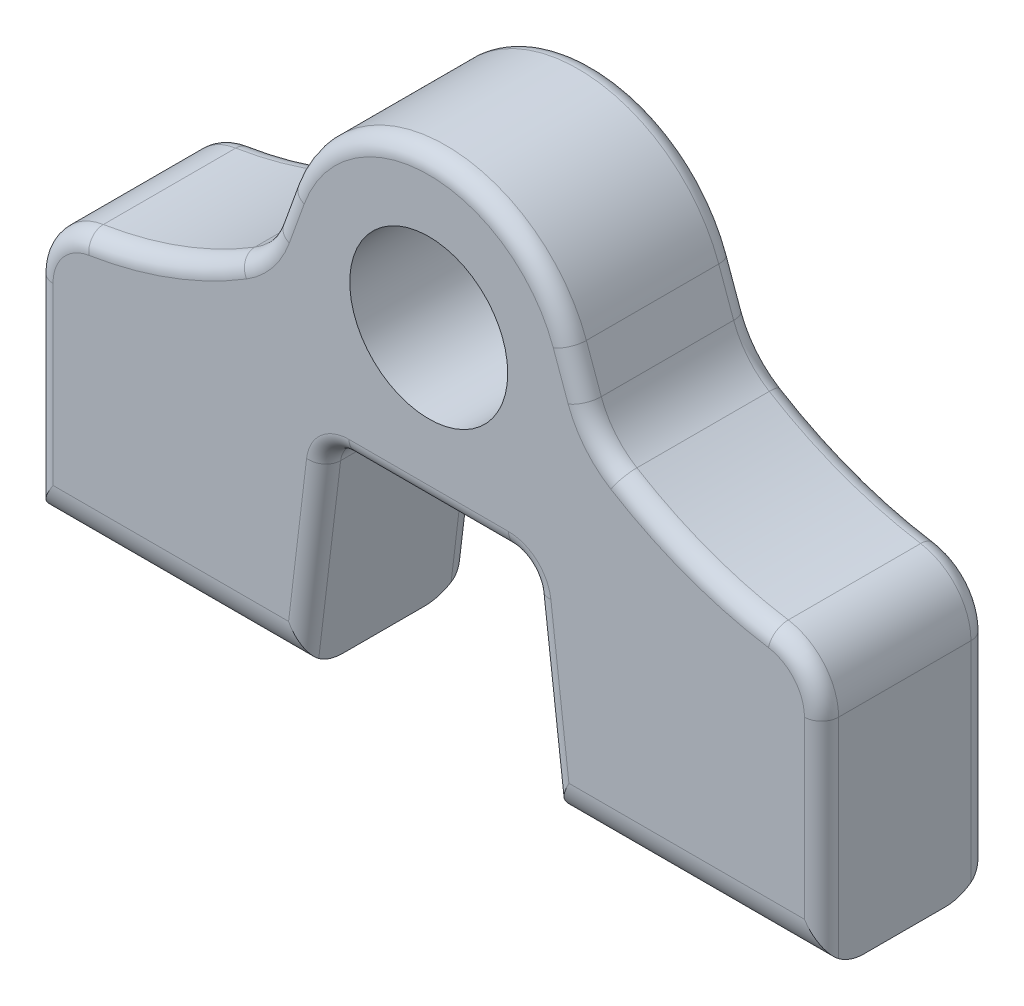
from build123d import *

# Parameters (mm, degrees)
CROQUIS1_R              = 9.25
SALIENTE_EXTRUIR1_DEPTH = 9.75
REDONDEO4_R             = 3
REDONDEO5_R             = 2
REDONDEO6_R             = 5


with BuildPart() as part:
    # Croquis1 → Saliente-Extruir1 (new, symmetric)
    with BuildSketch(Plane.XY):
        with BuildLine():
            Line((16.461713879, 5.938179534), (18.205490224, 1.104114294))
            ThreePointArc((18.205490224, 1.104114294), (19.855946903, -1.814596224), (22.378427867, -4.023661212))
            ThreePointArc((22.378427867, -4.023661212), (30.919049272, -8.178302275), (40.105510362, -10.589150466))
            ThreePointArc((40.105510362, -10.589150466), (44.326282594, -12.959198031), (46, -17.50130258))
            Line((46, -17.50130258), (46, -18.509558121))
            Line((46, -18.509558121), (46, -43))
            Line((46, -43), (15, -43))
            Line((15, -43), (12, -18))
            Line((12, -18), (-12, -18))
            Line((-12, -18), (-15, -43))
            Line((-15, -43), (-46, -43))
            Line((-46, -43), (-46, -18.509558121))
            Line((-46, -18.509558121), (-46, -17.50130258))
            ThreePointArc((-46, -17.50130258), (-44.326282594, -12.959198031), (-40.105510362, -10.589150466))
            ThreePointArc((-40.105510362, -10.589150466), (-30.919049272, -8.178302275), (-22.378427867, -4.023661212))
            ThreePointArc((-22.378427867, -4.023661212), (-19.855946903, -1.814596224), (-18.205490224, 1.104114294))
            Line((-18.205490224, 1.104114294), (-16.461713879, 5.938179534))
            ThreePointArc((-16.461713879, 5.938179534), (0, 17.5), (16.461713879, 5.938179534))
        make_face()
        Circle(CROQUIS1_R, mode=Mode.SUBTRACT)
    extrude(amount=SALIENTE_EXTRUIR1_DEPTH, both=True)

    # Redondeo4
    redondeo4_edges = [part.edges().sort_by_distance(p)[0] for p in [
        (12, -18, 0),
        (-12, -18, 0),
    ]]
    fillet(redondeo4_edges, radius=REDONDEO4_R)

    # Redondeo5
    redondeo5_edges = [part.edges().sort_by_distance(p)[0] for p in [
        (-19.855946903, -1.814596224, 9.75),
        (-30.919049272, -8.178302275, 9.75),
        (17.333602052, 3.521146914, -9.75),
        (-44.326282594, -12.959198031, 9.75),
        (19.855946903, -1.814596224, -9.75),
        (30.919049272, -8.178302275, -9.75),
        (44.326282594, -12.959198031, -9.75),
        (46, -30.25065129, -9.75),
        (-46, -30.25065129, 9.75),
        (-13.65855386, -31.821282169, -9.75),
        (-46, -30.25065129, -9.75),
        (-44.326282594, -12.959198031, -9.75),
        (-30.919049272, -8.178302275, -9.75),
        (-19.855946903, -1.814596224, -9.75),
        (-17.333602052, 3.521146914, -9.75),
        (0, 17.5, -9.75),
        (-13.65855386, -31.821282169, 9.75),
        (0, 17.5, 9.75),
        (46, -30.25065129, 9.75),
        (44.326282594, -12.959198031, 9.75),
        (30.919049272, -8.178302275, 9.75),
        (19.855946903, -1.814596224, 9.75),
        (13.65855386, -31.821282169, -9.75),
        (13.65855386, -31.821282169, 9.75),
        (0, -18, -9.75),
        (17.333602052, 3.521146914, 9.75),
        (0, -18, 9.75),
        (11.329418316, -18.755862417, -9.75),
        (11.329418316, -18.755862417, 9.75),
        (-11.329418316, -18.755862417, -9.75),
        (-11.329418316, -18.755862417, 9.75),
        (-17.333602052, 3.521146914, 9.75),
    ]]
    fillet(redondeo5_edges, radius=REDONDEO5_R)

    # Redondeo6
    # the kernel refuses this fillet: 5 mm, written as the material it takes off along each edge
    with BuildSketch(Plane(origin=(56.5, -43, 9.75), x_dir=(0, 1, 0), z_dir=(-1, 0, 0)), Plane(origin=(-4.51434853, -43, 9.75), x_dir=(0, 1, 0), z_dir=(-1, 0, 0)), Plane(origin=(56.5, -43, -9.75), x_dir=(0, 0, 1), z_dir=(-1, 0, 0)), Plane(origin=(-4.51434853, -43, -9.75), x_dir=(0, 0, 1), z_dir=(-1, 0, 0))) as redondeo6_piece_1:
        with BuildLine():
            CenterArc((REDONDEO6_R, REDONDEO6_R), REDONDEO6_R, 180, 90)
            Line((0, REDONDEO6_R), (0, 0))
            Line((0, 0), (REDONDEO6_R, 0))
        make_face()
    extrude(amount=51.98565147, mode=Mode.SUBTRACT)


solid = part.part
